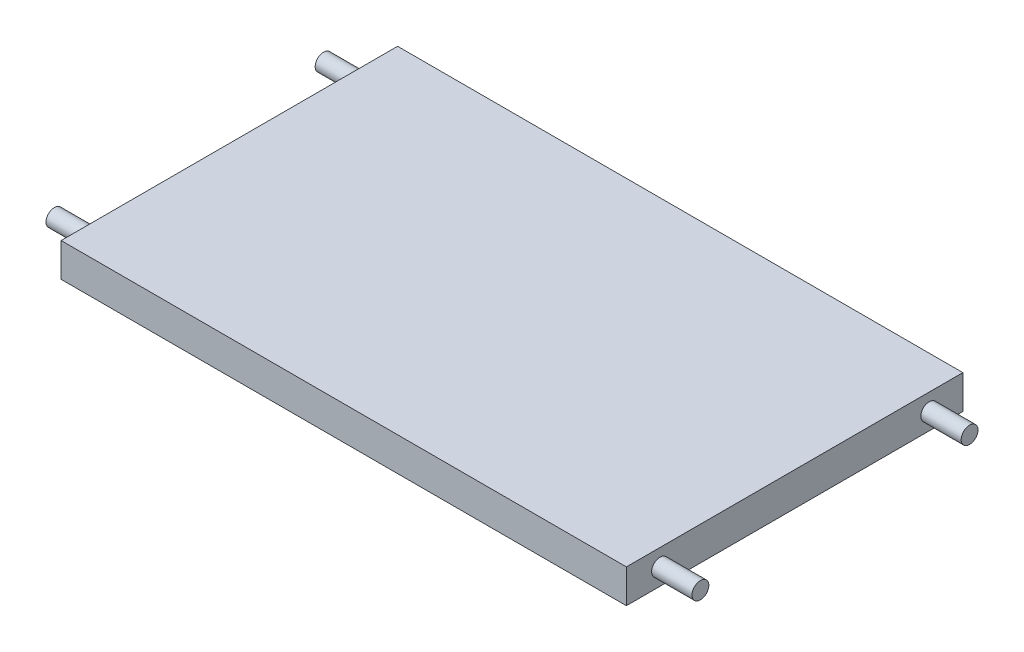
from build123d import *

# Parameters (mm, degrees)
SKETCH_1_W      = 168
SKETCH_1_H      = 100
EXTRUDE_1_DEPTH = 10
SKETCH_2_R      = 2.5
EXTRUDE_2_DEPTH = 12
EXTRUDE_START   = 12
SKETCH_3_R      = 2.5
EXTRUDE_3_DEPTH = 12


with BuildPart() as part:
    # 草图1 → 凸台-拉伸1 (new body)
    with BuildSketch(Plane(origin=(0, 0, 0), x_dir=(1, 0, 0), z_dir=(0, 1, 0))):
        Rectangle(SKETCH_1_W, SKETCH_1_H)
    extrude(amount=EXTRUDE_1_DEPTH)

    # 草图2 → 凸台-拉伸2 (add)
    with BuildSketch(Plane.ZY.offset(84)):
        with Locations((-40, 5)):
            Circle(SKETCH_2_R)
        with Locations((40, 5)):
            Circle(SKETCH_2_R)
    extrude(amount=EXTRUDE_2_DEPTH)

    # 草图3 → 凸台-拉伸3 (add)
    with BuildSketch(Plane(origin=(84, 0, 0), x_dir=(0, 0, -1), z_dir=(1, 0, 0)).offset(EXTRUDE_START)):
        with Locations((-40, 5)):
            Circle(SKETCH_3_R)
        with Locations((40, 5)):
            Circle(SKETCH_3_R)
    extrude(amount=-EXTRUDE_3_DEPTH)


solid = part.part
